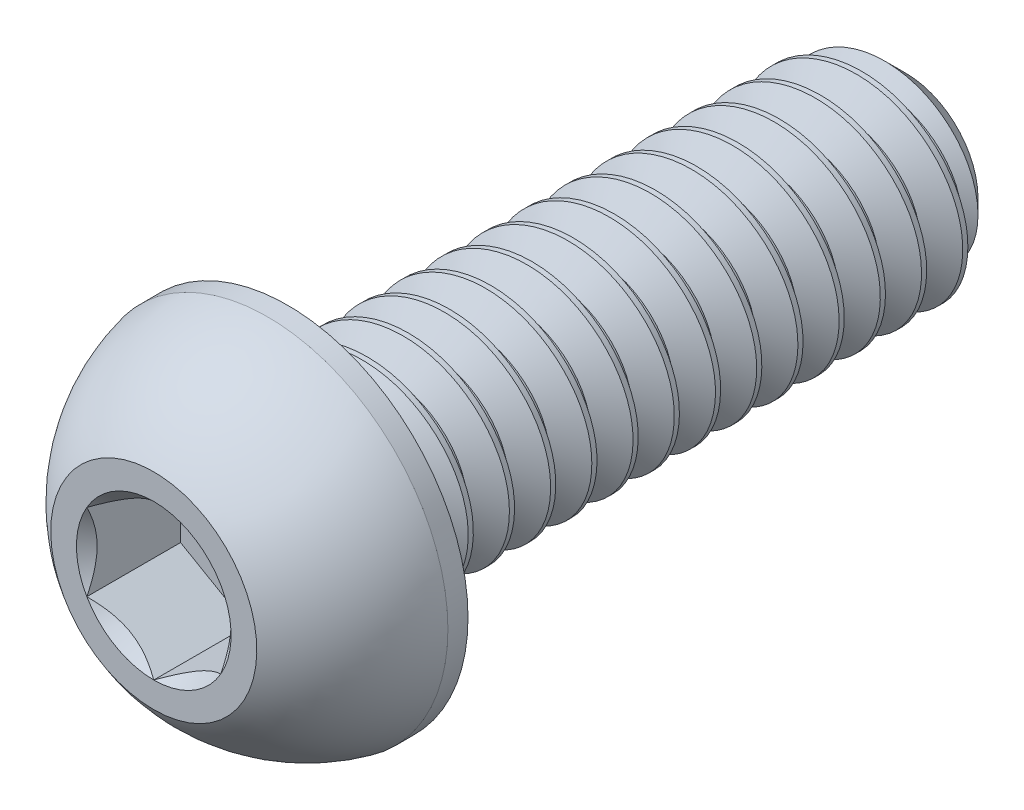
from build123d import *

# Parameters (mm, degrees)
SKETCH1_W          = 6
SKETCH1_H          = 1
CHAMFER1_SIZE      = 0.3
CUT_SWEEP1_PITCH   = 0.4
CUT_EXTRUDE2_DEPTH = 0.91


with BuildPart() as part:
    # Sketch1 → Revolve1 (revolve)
    with BuildSketch(Plane(origin=(0, 0, 0), x_dir=(0, 0, -1), z_dir=(1, 0, 0))):
        with Locations((4.3, 0.5)):
            Rectangle(SKETCH1_W, SKETCH1_H)
    revolve(axis=Axis((0, 0, -7.3), (0, 0, 1)))

    # Chamfer1
    chamfer1_edges = [part.edges().sort_by_distance(p)[0] for p in [
        (0, -1, -7.3),
    ]]
    chamfer(chamfer1_edges, length=CHAMFER1_SIZE)

    # Cut-Sweep1: arcs per turn and ends read off the stored shape
    # Cut-Sweep1: the profile of Sketch2 profile screwed along a right-hand helix through 16 turns, 6 arcs to a turn; built about Z, then put on its axis
    cut_sweep1_z = Axis((0, 0, 0), (0, 0, 1))
    cut_sweep1_corners = [(1.0003, 0, 0.000173224), (1.0003, 0, -0.350173186), (0.740192379, 0, -0.199999981), (0.740192379, 0, -0.149999981)]
    with BuildLine(mode=Mode.PRIVATE) as cut_sweep1_profile:
        Line(cut_sweep1_corners[0], cut_sweep1_corners[1])
        Line(cut_sweep1_corners[1], cut_sweep1_corners[2])
        Line(cut_sweep1_corners[2], cut_sweep1_corners[3])
        Line(cut_sweep1_corners[3], cut_sweep1_corners[0])
    cut_sweep1_cap = Face(cut_sweep1_profile.wire())
    cut_sweep1_turn_angles = [0, 30, 60, 90, 120, 150, 180, 210, 240, 270, 300, 330, 360]
    cut_sweep1_turn_weights = [1, 0.8660254037844387, 1, 0.8660254037844387, 1, 0.8660254037844387, 1, 0.8660254037844387, 1, 0.8660254037844387, 1, 0.8660254037844387, 1]
    cut_sweep1_turn_rails = [Edge.make_bspline([Vector(p[0], p[1], 0).rotate(cut_sweep1_z, cut_sweep1_turn_angles[k]) / cut_sweep1_turn_weights[k] + Vector(0, 0, p[2] + CUT_SWEEP1_PITCH * cut_sweep1_turn_angles[k] / 360) for k in range(13)], [0, 0, 0, 1, 1, 2, 2, 3, 3, 4, 4, 5, 5, 6, 6, 6], 2, cut_sweep1_turn_weights) for p in cut_sweep1_corners]
    cut_sweep1_turn_sides = [Face.make_surface_from_curves(cut_sweep1_turn_rails[p[0]], cut_sweep1_turn_rails[p[1]]) for p in [(0, 1), (1, 2), (2, 3), (3, 0)]]
    cut_sweep1 = Plane(origin=(0, 0, -7.3), x_dir=(1, 0, 0), z_dir=(0, 0, 1)) * Solid(Shell([*[p.moved(Location((0, 0, CUT_SWEEP1_PITCH * i))) for i in range(16) for p in cut_sweep1_turn_sides], cut_sweep1_cap, cut_sweep1_cap.rotate(cut_sweep1_z, 5760).moved(Location((0, 0, CUT_SWEEP1_PITCH * 5760 / 360)))]))
    add(cut_sweep1, mode=Mode.SUBTRACT)

    # Sketch7 → Revolve2 (revolve)
    with BuildSketch(Plane(origin=(0, 0, 0), x_dir=(0, 0, -1), z_dir=(1, 0, 0)), mode=Mode.PRIVATE) as revolve2_sk:
        with BuildLine():
            Line((1.105, 1.75), (1.3, 1.75))
            Line((1.3, 1.75), (1.3, 0))
            Line((1.3, 0), (0, 0))
            Line((0, 0), (0, 1))
            ThreePointArc((0, 1), (0.479976957, 1.481850617), (1.105, 1.75))
        make_face()
    revolve(revolve2_sk.sketch.rotate(Axis((0, 0, 0), (0, 0, -1)), 180), axis=Axis((0, 0, 0), (0, 0, -1)))

    # Sketch5 → Cut-Extrude2 (cut)
    with BuildSketch(Plane.XY):
        Polygon((0.65, -0.375277675), (0.65, 0.375277675), (0, 0.75055535), (-0.65, 0.375277675), (-0.65, -0.375277675), (0, -0.75055535), align=None)
    extrude(amount=-CUT_EXTRUDE2_DEPTH, mode=Mode.SUBTRACT)

    # Cut-Extrude3 cone 1 section (through the dimple's axis) → Cut-Extrude3 (revolve, cut)
    with BuildSketch(Plane(origin=(0, 0, 0), x_dir=(0, -1, 0), z_dir=(1, 0, 0))):
        Polygon((0, 0), (0.75055535, 0), (0, 0.75055535), align=None)
    revolve(axis=Axis((0, 0, 0), (0, 0, -1)), mode=Mode.SUBTRACT)


solid = part.part
